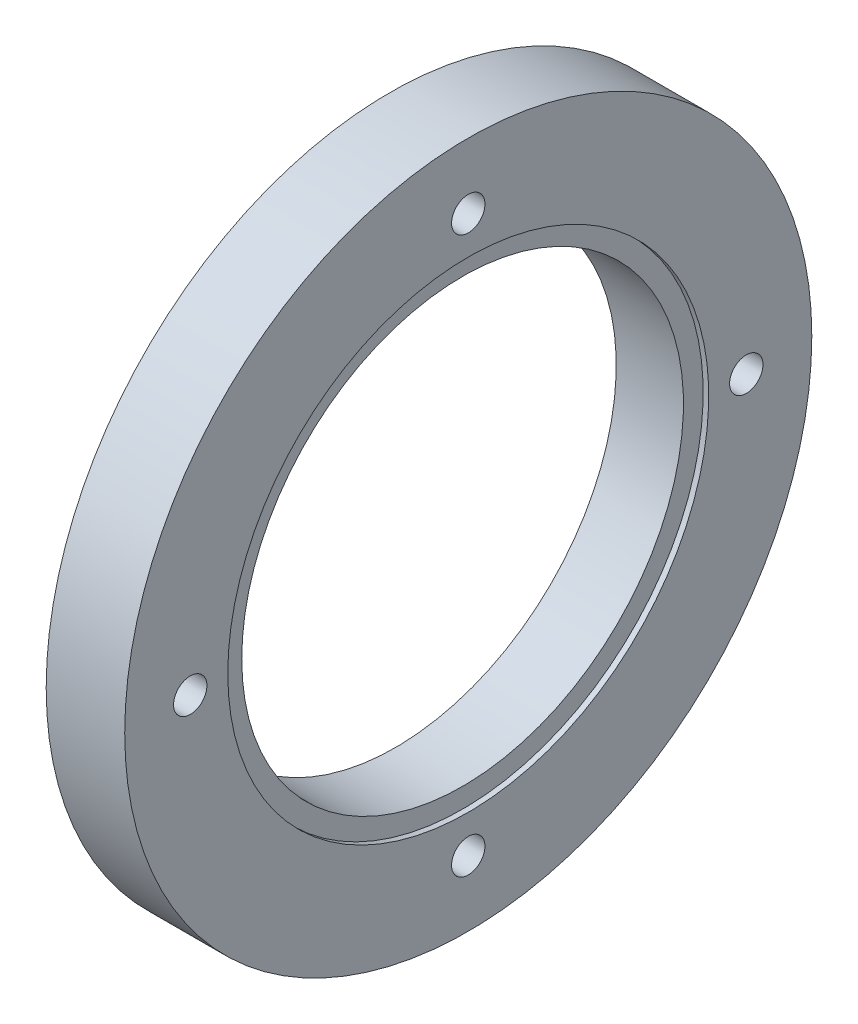
from build123d import *

# Parameters (mm, degrees)
M3_CLEARANCE_HOLE1_D     = 3.4
M3_CLEARANCE_HOLE1_DEPTH = 8
M3_CLEARANCE_HOLE1_TIP   = 1.021463052


with BuildPart() as part:
    # Sketch1 → Revolve17 (revolve)
    with BuildSketch(Plane.XY):
        Polygon((17.640221824, 24.5), (17.640221824, 35), (9.640221824, 35), (9.640221824, 24.5), (10.206221824, 24.5), (10.217946434, 22.500034367), (15.062497214, 22.500034367), (17.062497214, 22.500034367), (17.074221824, 24.5), align=None)
    revolve(axis=Axis((-801.920554309, 0, 0), (1, 0, 0)))

    # M3 Clearance Hole1
    with Locations(Plane.ZY.offset(-9.640221824)):
        with Locations((0, -28.325), (0, 28.325), (28.325, 0), (-28.325, 0)):
            Hole(M3_CLEARANCE_HOLE1_D / 2, depth=M3_CLEARANCE_HOLE1_DEPTH)
            with Locations((0, 0, -(M3_CLEARANCE_HOLE1_DEPTH + M3_CLEARANCE_HOLE1_TIP / 2))):  # 118° drill point
                Cone(0, M3_CLEARANCE_HOLE1_D / 2, M3_CLEARANCE_HOLE1_TIP, mode=Mode.SUBTRACT)


solid = part.part
